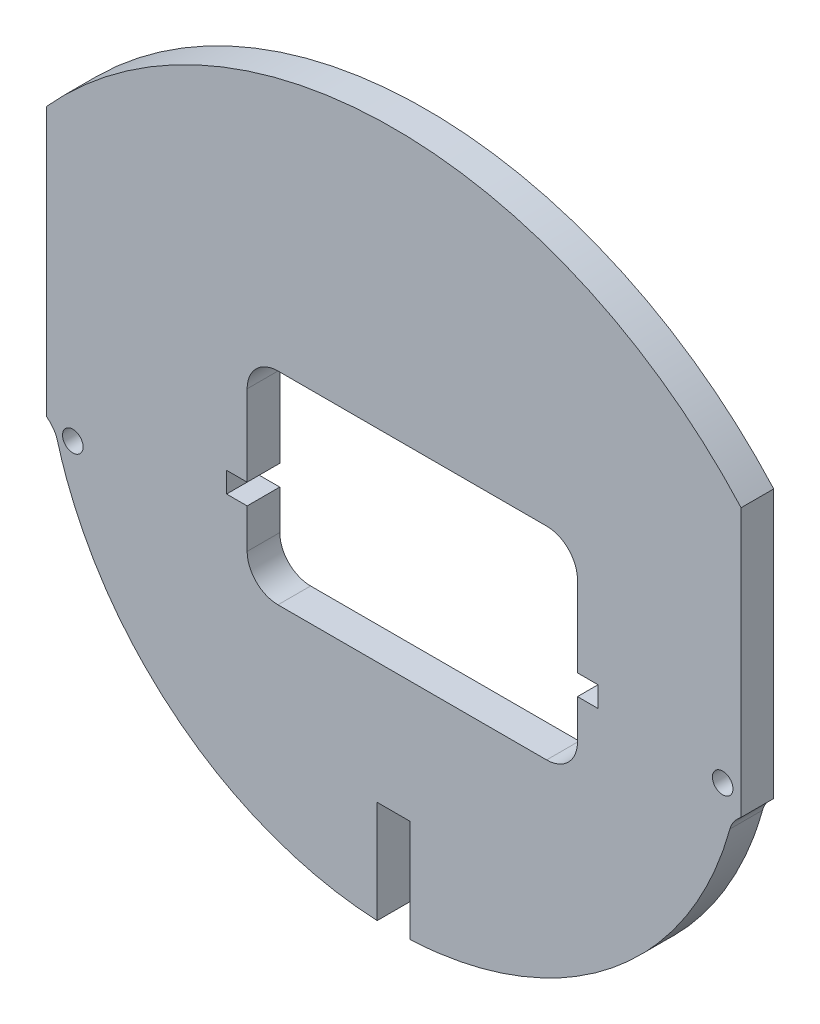
from build123d import *

# Parameters (mm, degrees)
BOSS_EXTRUDE1_DEPTH = 3.175
SKETCH2_R           = 1
CUT_EXTRUDE1_DEPTH  = 3.175
SKETCH3_W           = 3.175
SKETCH3_H           = 10.970571453
CUT_EXTRUDE2_DEPTH  = 48.905483945
CUT_EXTRUDE3_DEPTH  = 48.905483945


with BuildPart() as part:
    # Sketch1 → Boss-Extrude1 (new body)
    with BuildSketch(Plane.XY.offset(299.790013628)):
        with BuildLine():
            Line((33.800017398, -7.366761895), (33.800017398, 18.725816778))
            ThreePointArc((33.800017398, 18.725816778), (-0.000557823, 33.799609088), (-33.799982602, 18.723237361))
            Line((-33.799982602, 18.723237361), (-33.799982602, -7.366777732))
            add(Edge.make_bspline(
                [(-33.799982602, -7.366777732), (-33.672789327, -7.463259542), (-33.552121131, -7.566964097), (-33.326159842, -7.79139223), (-33.221125409, -7.912162508), (-33.034465703, -8.166471978), (-32.952054517, -8.300699067), (-32.811712114, -8.585009668), (-32.753980555, -8.735399478), (-32.711505515, -8.889768336)],
                knots=[0, 0, 0, 0, 0.25, 0.25, 0.5, 0.5, 0.75, 0.75, 1, 1, 1, 1], degree=3))
            add(Edge.make_bspline(
                [(-32.711505515, -8.889768336), (-32.218545569, -10.681353815), (-31.582970442, -12.406292143), (-30.046873209, -15.732353364), (-29.149732094, -17.335056266), (-27.853684449, -19.256830618), (-27.585876179, -19.636654103), (-27.037545067, -20.380994298), (-26.194235478, -21.477177142), (-25.289410486, -22.513279461), (-23.400136465, -24.507717332), (-22.036872596, -25.736014695), (-20.198644798, -27.140367507), (-19.823359112, -27.415057973), (-18.307010857, -28.47732838), (-17.130998838, -29.195842865), (-14.299650354, -30.696188469), (-12.615858618, -31.420604816), (-9.99268241, -32.310524634), (-9.099644071, -32.573674181), (-7.309378259, -33.021437293), (-4.607325738, -33.579354316), (-1.855822888, -33.799578534), (7.014e-06, -33.799609106)],
                knots=[0, 0, 0, 0, 0.125, 0.125, 0.25, 0.25, 0.28125, 0.28125, 0.3125, 0.375, 0.375, 0.5, 0.5, 0.53125, 0.53125, 0.625, 0.625, 0.75, 0.75, 0.8125, 0.8125, 0.875, 1, 1, 1, 1], degree=3))
            add(Edge.make_bspline(
                [(7.014e-06, -33.799609106), (3.71198449, -33.799546475), (7.323818522, -33.211894011), (11.272281305, -31.876901766), (11.709255106, -31.719210387), (12.572214597, -31.3883335), (13.853276296, -30.867912798), (16.748236975, -29.483886242), (19.066155809, -28.003005579), (20.904820016, -26.601476418), (21.26870544, -26.312112405), (21.981822477, -25.721047769), (22.331302421, -25.41922276), (23.359250005, -24.495530592), (25.333391288, -22.575468921), (27.05775769, -20.433363088), (28.609537919, -18.137832091), (29.098956145, -17.344856534), (30.005077972, -15.734456147), (30.424297285, -14.914397351), (31.581811664, -12.410251613), (32.218491785, -10.681549287), (32.711505515, -8.889768336)],
                knots=[0, 0, 0, 0, 0.25, 0.25, 0.28125, 0.28125, 0.3125, 0.375, 0.5, 0.5, 0.53125, 0.53125, 0.5625, 0.5625, 0.625, 0.75, 0.75, 0.8125, 0.8125, 0.875, 0.875, 1, 1, 1, 1], degree=3))
            add(Edge.make_bspline(
                [(32.711505515, -8.889768336), (32.79670017, -8.580141747), (32.939002514, -8.296331804), (33.317854255, -7.780583107), (33.545155986, -7.560077249), (33.800017398, -7.366761895)],
                knots=[0, 0, 0, 0, 0.5, 0.5, 1, 1, 1, 1], degree=3))
        make_face()
    extrude(amount=-BOSS_EXTRUDE1_DEPTH)

    # Sketch2 → Cut-Extrude1 (cut)
    with BuildSketch(Plane(origin=(0, 0, 296.615013628), x_dir=(-1, 0, 0), z_dir=(0, 0, -1))):
        with Locations((-32.009302375, -5.358989516)):
            Circle(SKETCH2_R)
        with Locations((31.216064399, -8.164436653)):
            Circle(SKETCH2_R)
    extrude(amount=-CUT_EXTRUDE1_DEPTH, mode=Mode.SUBTRACT)

    # Sketch3 → Cut-Extrude2 (cut, through all)
    with BuildSketch(Plane.XY.offset(299.790013628)):
        with Locations((-0.013127042, -29.284890239)):
            Rectangle(SKETCH3_W, SKETCH3_H)
    extrude(amount=-CUT_EXTRUDE2_DEPTH, mode=Mode.SUBTRACT)

    # Sketch4 → Cut-Extrude3 (cut, through all)
    with BuildSketch(Plane(origin=(0, 0, 296.615013628), x_dir=(-1, 0, 0), z_dir=(0, 0, -1))):
        with BuildLine():
            ThreePointArc((14.257724699, 4.717183699), (13.379045042, 6.838504042), (11.257724699, 7.717183699))
            Line((11.257724699, 7.717183699), (-14.878600613, 7.717183699))
            ThreePointArc((-14.878600613, 7.717183699), (-16.999920956, 6.838504042), (-17.878600613, 4.717183699))
            Line((-17.878600613, 4.717183699), (-17.878600613, -3.150157902))
            Line((-17.878600613, -3.150157902), (-19.878600613, -3.150157902))
            Line((-19.878600613, -3.150157902), (-19.878600613, -5.150157902))
            Line((-19.878600613, -5.150157902), (-17.878600613, -5.150157902))
            Line((-17.878600613, -5.150157902), (-17.878600613, -8.984256283))
            ThreePointArc((-17.878600613, -8.984256283), (-16.999920956, -11.105576627), (-14.878600613, -11.984256283))
            Line((-14.878600613, -11.984256283), (11.257724699, -11.984256283))
            ThreePointArc((11.257724699, -11.984256283), (13.379045042, -11.105576627), (14.257724699, -8.984256283))
            Line((14.257724699, -8.984256283), (14.257724699, -5.150157902))
            Line((14.257724699, -5.150157902), (16.257724699, -5.150157902))
            Line((16.257724699, -5.150157902), (16.257724699, -3.150157902))
            Line((16.257724699, -3.150157902), (14.257724699, -3.150157902))
            Line((14.257724699, -3.150157902), (14.257724699, 4.717183699))
        make_face()
    extrude(amount=-CUT_EXTRUDE3_DEPTH, mode=Mode.SUBTRACT)


solid = part.part
